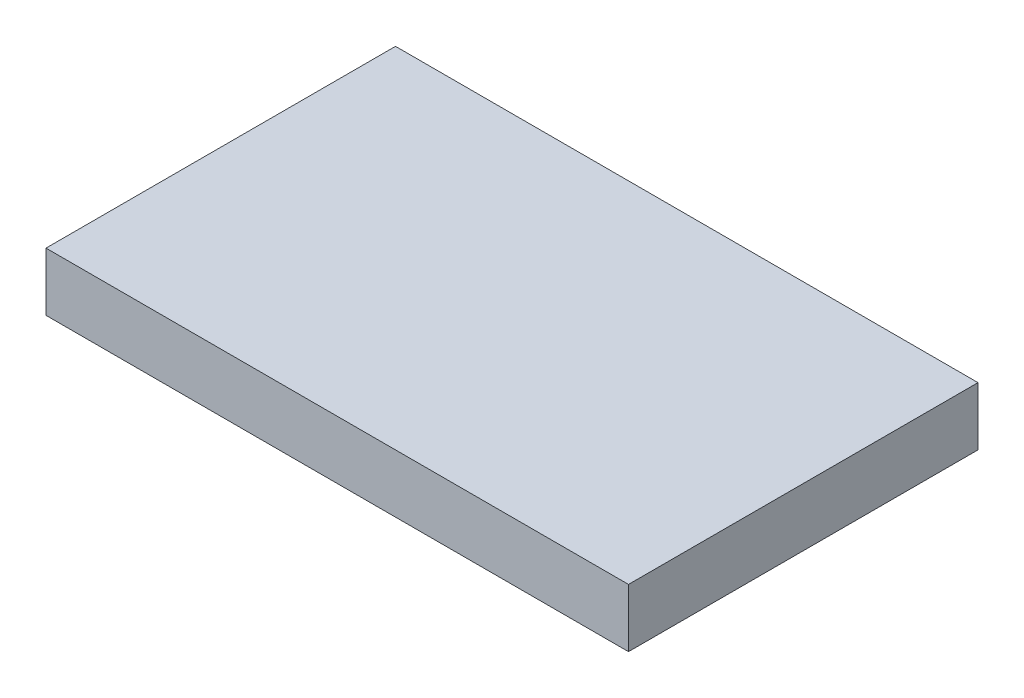
from build123d import *

# Parameters (mm, degrees)
SKETCH1_W           = 127
SKETCH1_H           = 76.2
BOSS_EXTRUDE1_DEPTH = 12.7


with BuildPart() as part:
    # Sketch1 → Boss-Extrude1 (new body)
    with BuildSketch(Plane(origin=(0, 0, 0), x_dir=(1, 0, 0), z_dir=(0, 1, 0))):
        Rectangle(SKETCH1_W, SKETCH1_H)
    extrude(amount=BOSS_EXTRUDE1_DEPTH)


solid = part.part
